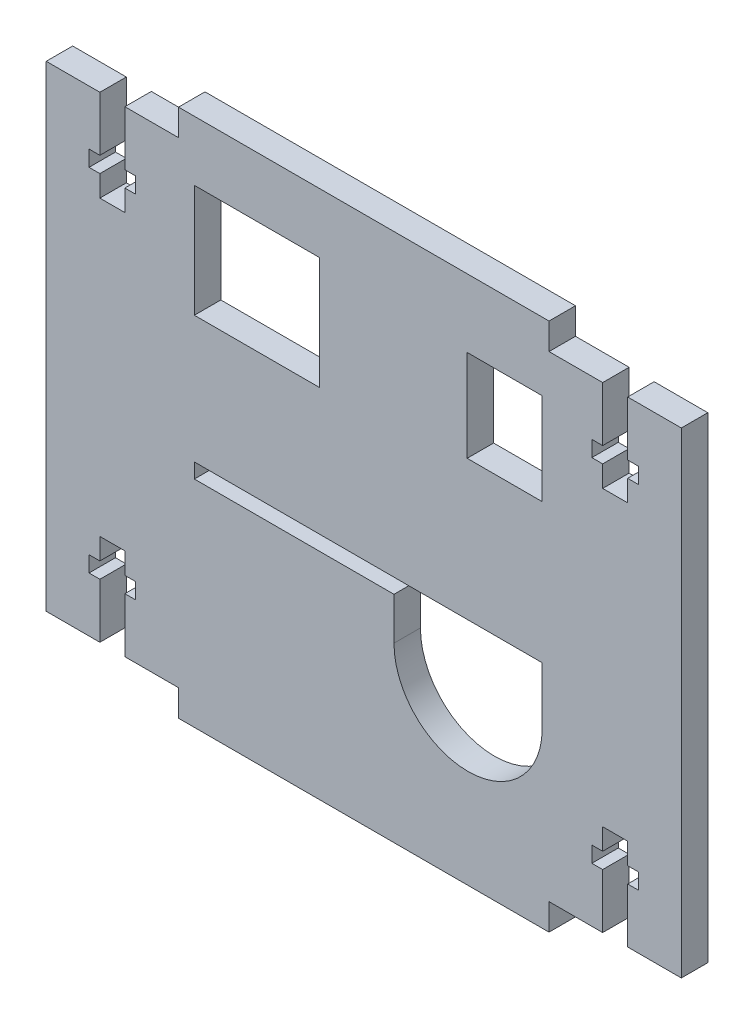
from build123d import *

# Parameters (mm, degrees)
SKETCH1_W           = 76.2
SKETCH1_H           = 63.5
BOSS_EXTRUDE1_DEPTH = 3.175
SKETCH2_W           = 15.875
SKETCH2_H           = 3.175
CUT_EXTRUDE1_DEPTH  = 50.6966108
CUT_EXTRUDE2_DEPTH  = 50.6966108
SKETCH4_W           = 15
SKETCH4_H           = 13.500000048
SKETCH4_W_2         = 8.999973617
SKETCH4_H_2         = 11
CUT_EXTRUDE3_DEPTH  = 50.6966108
CUT_EXTRUDE4_DEPTH  = 50.6966108


with BuildPart() as part:
    # Sketch1 → Boss-Extrude1 (new body)
    with BuildSketch(Plane.XY):
        Rectangle(SKETCH1_W, SKETCH1_H)
    extrude(amount=BOSS_EXTRUDE1_DEPTH)

    # Sketch2 → Cut-Extrude1 (cut, through all)
    with BuildSketch(Plane(origin=(0, 0, 0), x_dir=(-1, 0, 0), z_dir=(0, 0, -1))):
        with Locations((-30.1625, -30.1625)):
            Rectangle(SKETCH2_W, SKETCH2_H)
        with Locations((30.1625, -30.1625)):
            Rectangle(SKETCH2_W, SKETCH2_H)
        with Locations((30.1625, 30.1625)):
            Rectangle(SKETCH2_W, SKETCH2_H)
        with Locations((-30.1625, 30.1625)):
            Rectangle(SKETCH2_W, SKETCH2_H)
    extrude(amount=-CUT_EXTRUDE1_DEPTH, mode=Mode.SUBTRACT)

    # Sketch3 → Cut-Extrude2 (cut, through all)
    with BuildSketch(Plane.XY.offset(3.175)):
        Polygon((31.6625, -17.575), (31.6625, -20.125), (32.9625, -20.125), (32.9625, -22.025), (31.6625, -22.025), (31.6625, -28.575), (28.6625, -28.575), (28.6625, -22.025), (27.3625, -22.025), (27.3625, -20.125), (28.6625, -20.125), (28.6625, -17.575), align=None)
        Polygon((-31.6625, -20.125), (-32.9625, -20.125), (-32.9625, -22.025), (-31.6625, -22.025), (-31.6625, -28.575), (-28.6625, -28.575), (-28.6625, -22.025), (-27.3625, -22.025), (-27.3625, -20.125), (-28.6625, -20.125), (-28.6625, -17.575), (-31.6625, -17.575), align=None)
        Polygon((31.6625, 20.125), (32.9625, 20.125), (32.9625, 22.025), (31.6625, 22.025), (31.6625, 28.575), (28.6625, 28.575), (28.6625, 22.025), (27.3625, 22.025), (27.3625, 20.125), (28.6625, 20.125), (28.6625, 17.575), (31.6625, 17.575), align=None)
        Polygon((-31.6625, 17.575), (-31.6625, 20.125), (-32.9625, 20.125), (-32.9625, 22.025), (-31.6625, 22.025), (-31.6625, 28.575), (-28.6625, 28.575), (-28.6625, 22.025), (-27.3625, 22.025), (-27.3625, 20.125), (-28.6625, 20.125), (-28.6625, 17.575), align=None)
    extrude(amount=-CUT_EXTRUDE2_DEPTH, mode=Mode.SUBTRACT)

    # Sketch4 → Cut-Extrude3 (cut, through all)
    with BuildSketch(Plane.XY.offset(3.175)):
        with Locations((-12.825660003, 17.824999976)):
            Rectangle(SKETCH4_W, SKETCH4_H)
        with Locations((16.904087035, 18.075)):
            Rectangle(SKETCH4_W_2, SKETCH4_H_2)
    extrude(amount=-CUT_EXTRUDE3_DEPTH, mode=Mode.SUBTRACT)

    # Sketch5 → Cut-Extrude4 (cut, through all)
    with BuildSketch(Plane.XY.offset(3.175)):
        with BuildLine():
            Line((-20.325660003, -5.943000048), (3.624073843, -5.943000048))
            Line((3.624073843, -5.943000048), (3.624073843, -11.023000048))
            ThreePointArc((3.624073843, -11.023000048), (12.514073843, -19.913000048), (21.404073843, -11.023000048))
            Line((21.404073843, -11.023000048), (21.404073843, -7.975000048))
            Line((21.404073843, -7.975000048), (21.404073843, -4.165000048))
            Line((21.404073843, -4.165000048), (-20.325660003, -4.165000048))
            Line((-20.325660003, -4.165000048), (-20.325660003, -5.943000048))
        make_face()
    extrude(amount=-CUT_EXTRUDE4_DEPTH, mode=Mode.SUBTRACT)


solid = part.part
